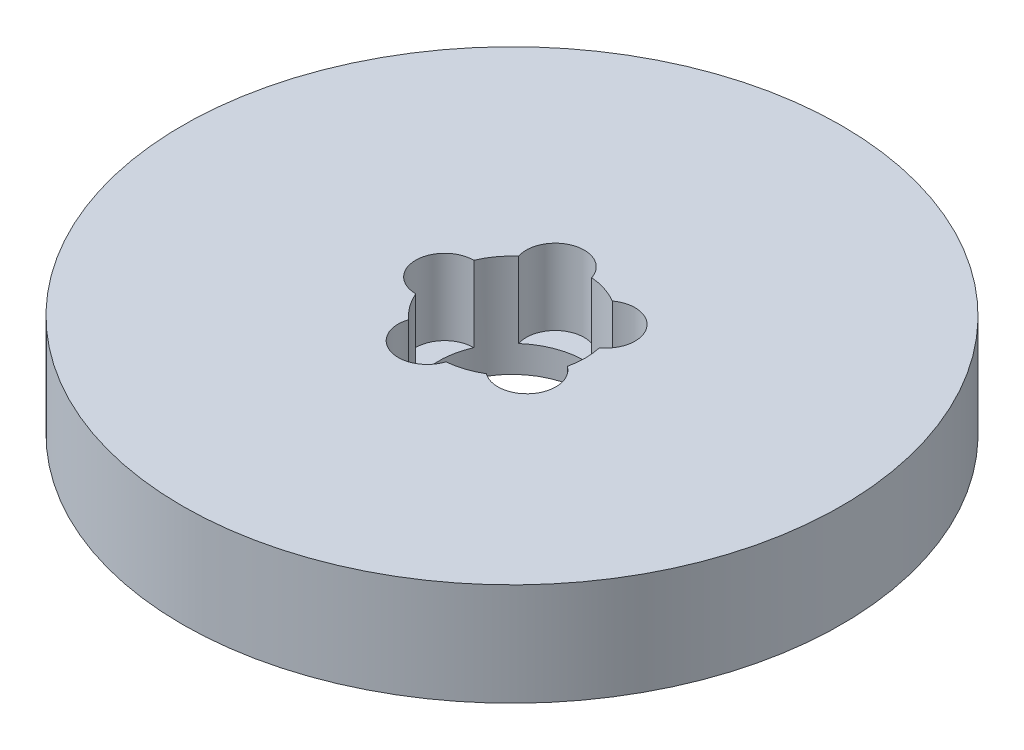
from build123d import *

# Parameters (mm, degrees)
SKETCH1_R           = 22.5
BOSS_EXTRUDE1_DEPTH = 7
SKETCH2_R           = 5
CUT_EXTRUDE1_DEPTH  = 33.580669115
SKETCH3_R           = 1.981426301
CUT_EXTRUDE2_DEPTH  = 5.165945731
CIRPATTERN1_COUNT   = 5


with BuildPart() as part:
    # Sketch1 → Boss-Extrude1 (new body)
    with BuildSketch(Plane(origin=(0, 0, 0), x_dir=(1, 0, 0), z_dir=(0, 1, 0))):
        Circle(SKETCH1_R)
    extrude(amount=BOSS_EXTRUDE1_DEPTH)

    # Sketch2 → Cut-Extrude1 (cut, through all)
    with BuildSketch(Plane(origin=(0, 0, 0), x_dir=(1, 0, 0), z_dir=(0, 1, 0))):
        Circle(SKETCH2_R)
    extrude(amount=CUT_EXTRUDE1_DEPTH, mode=Mode.SUBTRACT)

    # Sketch3 → Cut-Extrude2 (cut)
    with BuildSketch(Plane(origin=(0, 7, 0), x_dir=(1, 0, 0), z_dir=(0, 1, 0))):
        with Locations((-4.596235577, 0)):
            Circle(SKETCH3_R)
    cut_extrude2 = extrude(amount=-CUT_EXTRUDE2_DEPTH, mode=Mode.SUBTRACT)

    # CirPattern1: Cut-Extrude2 ×5 about axis
    cirpattern1_axis = Axis((0, 0, 0), (0, 1, 0))
    for i in range(1, CIRPATTERN1_COUNT):
        add(cut_extrude2.rotate(cirpattern1_axis, i * 360 / CIRPATTERN1_COUNT), mode=Mode.SUBTRACT)


solid = part.part
